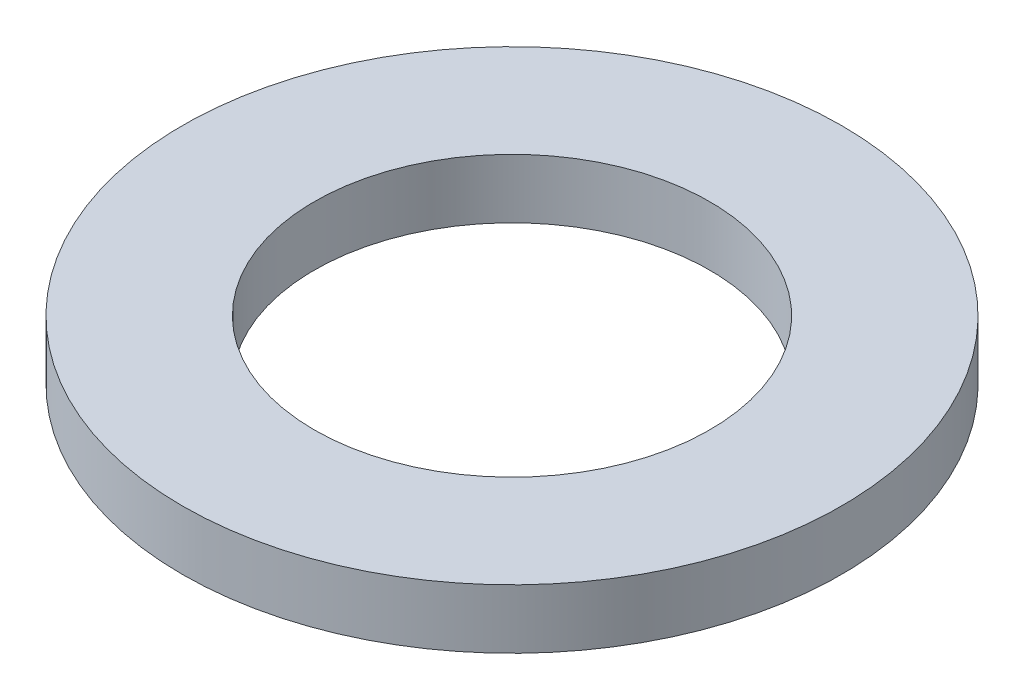
from build123d import *

# Parameters (mm, degrees)
SKETCH1_R           = 50
BOSS_EXTRUDE1_DEPTH = 9
SKETCH2_R           = 30
CUT_EXTRUDE1_DEPTH  = 72.281133549


with BuildPart() as part:
    # Sketch1 → Boss-Extrude1 (new body)
    with BuildSketch(Plane(origin=(0, 0, 0), x_dir=(1, 0, 0), z_dir=(0, 1, 0))):
        Circle(SKETCH1_R)
    extrude(amount=BOSS_EXTRUDE1_DEPTH)

    # Sketch2 → Cut-Extrude1 (cut, through all)
    with BuildSketch(Plane(origin=(0, 0, 0), x_dir=(1, 0, 0), z_dir=(0, 1, 0))):
        Circle(SKETCH2_R)
    extrude(amount=CUT_EXTRUDE1_DEPTH, mode=Mode.SUBTRACT)


solid = part.part
